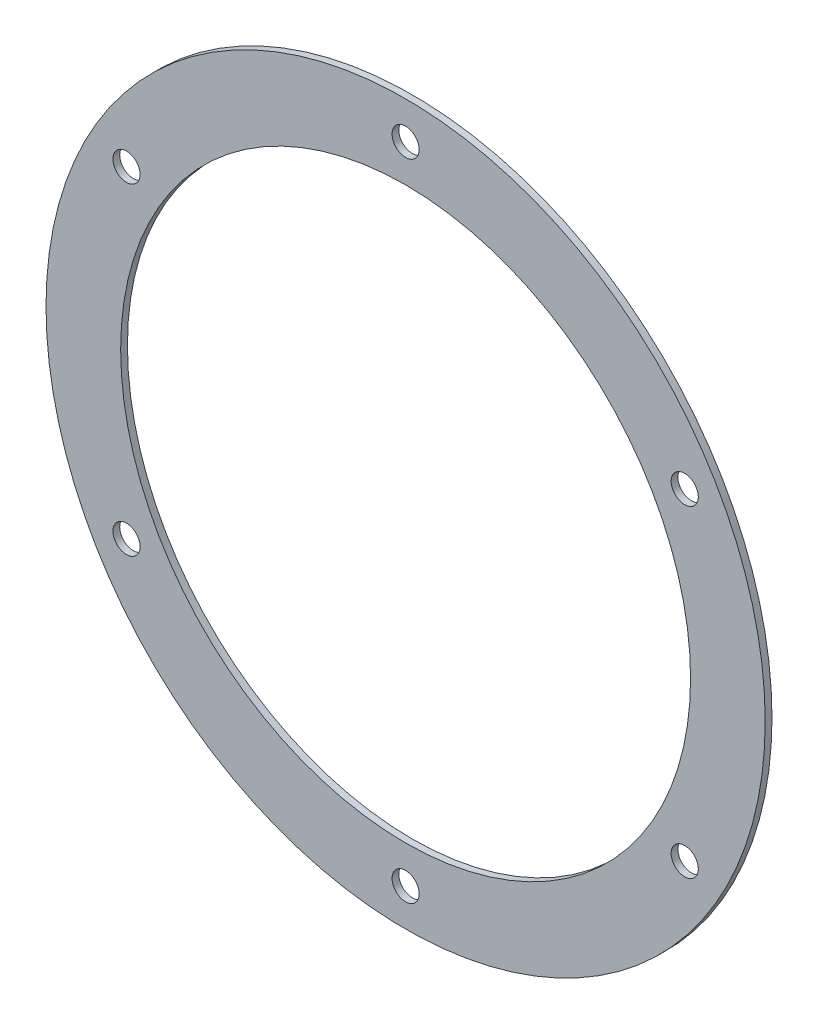
from build123d import *

# Parameters (mm, degrees)
SKIZZE2_R                       = 53
AUFSATZ_LINEAR_AUSTRAGEN2_DEPTH = 1
SKIZZE4_R                       = 2
SKIZZE4_R_2                     = 42
SCHNITT_LINEAR_AUSTRAGEN1_DEPTH = 42


with BuildPart() as part:
    # Skizze2 → Aufsatz-Linear austragen2 (new body)
    with BuildSketch(Plane.XY):
        Circle(SKIZZE2_R)
    extrude(amount=AUFSATZ_LINEAR_AUSTRAGEN2_DEPTH)

    # Skizze4 → Schnitt-Linear austragen1 (cut)
    with BuildSketch(Plane(origin=(0, 0, 0), x_dir=(-1, 0, 0), z_dir=(0, 0, -1))):
        with Locations((41.13620668, 23.75)):
            Circle(SKIZZE4_R)
        with Locations((41.13620668, -23.75)):
            Circle(SKIZZE4_R)
        with Locations((0, 47.5)):
            Circle(SKIZZE4_R)
        with Locations((0, -47.5)):
            Circle(SKIZZE4_R)
        with Locations((-41.13620668, 23.75)):
            Circle(SKIZZE4_R)
        with Locations((-41.13620668, -23.75)):
            Circle(SKIZZE4_R)
        Circle(SKIZZE4_R_2)
    extrude(amount=-SCHNITT_LINEAR_AUSTRAGEN1_DEPTH, mode=Mode.SUBTRACT)


solid = part.part
